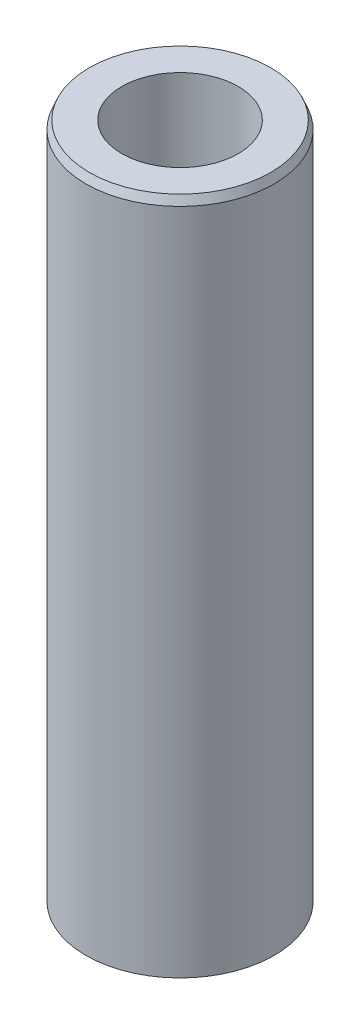
from build123d import *
from OCP.BRepFilletAPI import BRepFilletAPI_MakeChamfer

# Parameters (mm, degrees)
SKETCH1_R           = 40
BOSS_EXTRUDE1_DEPTH = 288.856588816
SKETCH2_R           = 24.743158942
CUT_EXTRUDE1_DEPTH  = 295.343555904
CHAMFER1_SIZE       = 3.502696678
CHAMFER1_SIZE2      = 1.454168011


with BuildPart() as part:
    # Sketch1 → Boss-Extrude1 (new body)
    with BuildSketch(Plane(origin=(0, 0, 0), x_dir=(1, 0, 0), z_dir=(0, 1, 0))):
        Circle(SKETCH1_R)
    extrude(amount=BOSS_EXTRUDE1_DEPTH)

    # Sketch2 → Cut-Extrude1 (cut, through all)
    with BuildSketch(Plane(origin=(0, 0, 0), x_dir=(1, 0, 0), z_dir=(0, 1, 0))):
        Circle(SKETCH2_R)
    extrude(amount=CUT_EXTRUDE1_DEPTH, mode=Mode.SUBTRACT)

    # Chamfer1: one chamfer whose edges measure the first distance from different faces: ONE call of the kernel's chamfer builder (chamfer() names one face for all edges)
    chamfer1_edges_1 = [part.edges().sort_by_distance(p)[0] for p in [
        (-40, 288.856588816, 0),
    ]]
    chamfer1_side_1 = [part.faces().sort_by_distance(p)[0] for p in [
        (-40, 144.428294408, 0),
    ]]
    chamfer1_edges_2 = [part.edges().sort_by_distance(p)[0] for p in [
        (-40, 0, 0),
    ]]
    chamfer1_side_2 = [part.faces().sort_by_distance(p)[0] for p in [
        (-38.86862915, 0, 0),
    ]]
    chamfer1 = BRepFilletAPI_MakeChamfer(part.part.solid().wrapped)
    for e in chamfer1_edges_1:
        chamfer1.Add(CHAMFER1_SIZE, CHAMFER1_SIZE2, e.wrapped, chamfer1_side_1[0].wrapped)  # the first distance lies on this face
    for e in chamfer1_edges_2:
        chamfer1.Add(CHAMFER1_SIZE, CHAMFER1_SIZE2, e.wrapped, chamfer1_side_2[0].wrapped)  # the first distance lies on this face
    add(Compound.cast(chamfer1.Shape()), mode=Mode.REPLACE)


solid = part.part
